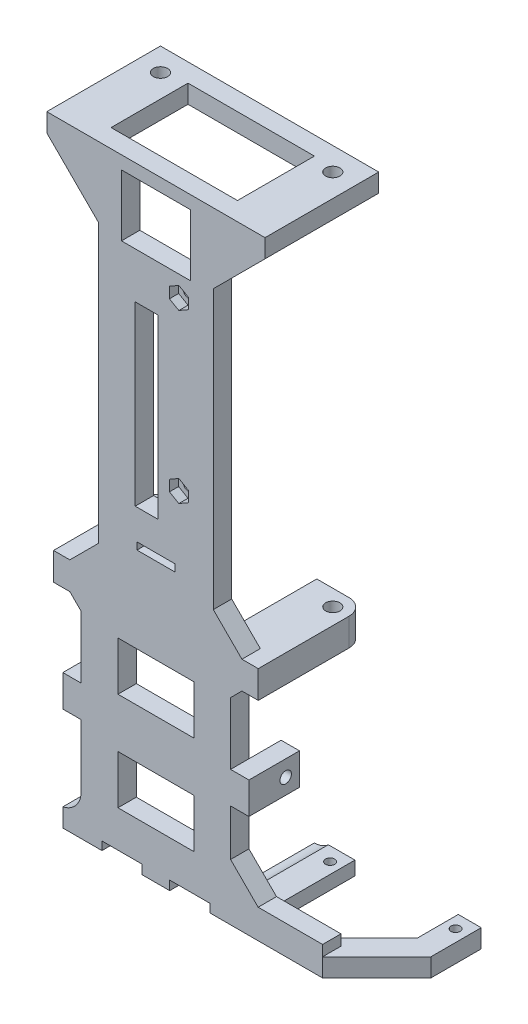
from build123d import *

# Parameters (mm, degrees)
EXTRUDE_1_DEPTH      = 4
SKETCH_2_W           = 15
SKETCH_2_H           = 13.3866
CUT_EXTRUDE_1_DEPTH  = 121.91505324
SKETCH_3_W           = 10
SKETCH_3_H           = 10
SKETCH_3_R           = 1.55
SKETCH_3_H_2         = 14.755
EXTRUDE_2_DEPTH      = 4
EXTRUDE_3_DEPTH      = 4
EXTRUDE_4_DEPTH      = 4
SKETCH_7_W           = 27.52
SKETCH_7_H           = 4
EXTRUDE_5_DEPTH      = 4
EXTRUDE_START        = -4
EXTRUDE_6_DEPTH      = 4
SKETCH_11_W          = 16.52
SKETCH_11_H          = 10.61
CUT_EXTRUDE_2_DEPTH  = 132.394668556
SKETCH_12_W          = 11
SKETCH_12_H          = 6.89
SKETCH_12_R          = 1.25
EXTRUDE_7568_DEPTH   = 4
SKETCH_14_R          = 1
CUT_EXTRUDE_3_DEPTH  = 131.700110654
SKETCH_15_R          = 0.9
EXTRUDE_9_DEPTH      = 1
FILLET_1_R           = 0.9
CUT_EXTRUDE_START    = -2
SKETCH_16_R          = 1
CUT_EXTRUDE_4_DEPTH  = 2
CUT_EXTRUDE_5_DEPTH  = 131.700110654
SKETCH_19_W          = 5
SKETCH_19_H          = 38.5268
SKETCH_19_W_2        = 8.236887868
SKETCH_19_H_2        = 1.55
CUT_EXTRUDE_6_DEPTH  = 131.700110654
EXTRUDE_12_DEPTH     = 23.28
CUT_EXTRUDE_7_REACH  = 99.296
SKETCH_23_R          = 1.55
EXTRUDE_13_DEPTH     = 4
CUT_EXTRUDE_START_2  = -19.28
CUT_EXTRUDE_8_DEPTH  = 19.48
SKETCH_26_W          = 10.1
SKETCH_26_H          = 2
EXTRUDE_14_DEPTH     = 3
EXTRUDE_15_DEPTH     = 18.755
CUT_EXTRUDE_9_REACH  = 145.246
SKETCH_28_R          = 1
EXTRUDE_START_2      = -10.1
EXTRUDE_16_DEPTH     = 10.1
FILLET_2_R           = 5
SKETCH_30_R          = 1
CUT_EXTRUDE_10_DEPTH = 140.530302533


# Read off the part's stored shape, not the designer's step: 切除-拉伸8
with BuildPart() as part:
    # 草图1 → 凸台-拉伸1 (new body)
    with BuildSketch(Plane.XY):
        with BuildLine():
            Line((-16.26, -7.25), (-16.26, 119.75))
            Line((-16.26, 119.75), (16.26, 119.75))
            Line((16.26, 119.75), (16.26, -7.25))
            ThreePointArc((16.26, -7.25), (14.939051583, -10.439051583), (11.75, -11.76))
            Line((11.75, -11.76), (-11.75, -11.76))
            ThreePointArc((-11.75, -11.76), (-14.939051583, -10.439051583), (-16.26, -7.25))
        make_face()
    extrude(amount=EXTRUDE_1_DEPTH)

    # 草图2 → 切除-拉伸1 (cut, through all)
    with BuildSketch(Plane(origin=(0, 0, 0), x_dir=(-1, 0, 0), z_dir=(0, 0, -1))):
        with Locations((0, 110.2067)):
            Rectangle(SKETCH_2_W, SKETCH_2_H)
    extrude(amount=-CUT_EXTRUDE_1_DEPTH, mode=Mode.SUBTRACT)

    # 草图3 → 凸台-拉伸2 (add)
    # profile 1 of 2: a face of its own
    with BuildSketch(Plane(origin=(0, 119.75, 0), x_dir=(1, 0, 0), z_dir=(0, 1, 0))):
        with Locations((-18.76, 15.755)):
            Rectangle(SKETCH_3_W, SKETCH_3_H)
        with Locations(Location((-18.76, 15.755, 0), (0, 0, 270))):
            Circle(SKETCH_3_R, mode=Mode.SUBTRACT)
    # profile 2 of 2: a face of its own
    with BuildSketch(Plane(origin=(0, 119.75, 0), x_dir=(1, 0, 0), z_dir=(0, 1, 0))):
        with Locations((-18.76, 3.3775)):
            Rectangle(SKETCH_3_W, SKETCH_3_H_2)
    extrude_2 = extrude(amount=-EXTRUDE_2_DEPTH)

    # 镜向1: 凸台-拉伸2 across plane
    add(extrude_2.mirror(Plane(origin=(0, 0, 0), x_dir=(0, 0, 1), z_dir=(1, 0, 0))))

    # 草图6 → 凸台-拉伸4 (add)
    with BuildSketch(Plane.XY.offset(4)):
        Polygon((-16.26, 115.75), (-23.76, 115.75), (-16.26, 108.25), align=None)
        Polygon((16.26, 115.75), (16.26, 108.25), (23.76, 115.75), align=None)
    extrude(amount=-EXTRUDE_4_DEPTH)

    # 草图7 → 凸台-拉伸5 (add)
    with BuildSketch(Plane(origin=(0, 119.75, 0), x_dir=(1, 0, 0), z_dir=(0, 1, 0))):
        with Locations((0, 18.755)):
            Rectangle(SKETCH_7_W, SKETCH_7_H)
    extrude(amount=-EXTRUDE_5_DEPTH)



with BuildPart() as body_2:
    # 草图5 → 凸台-拉伸3 (new body)
    with BuildSketch(Plane(origin=(0, -13.58, 0), x_dir=(1, 0, 0), z_dir=(0, 1, 0))):
        Polygon((47.78, 9.855), (43.08, 9.855), (29.225, -4), (36.296067812, -4), (48.08, 7.783932188), (48.08, 9.855), align=None)
        with BuildLine():
            Line((47.78, 18.755), (43.08, 18.755))
            Line((43.08, 18.755), (43.08, 9.855))
            Line((43.08, 9.855), (47.78, 9.855))
            Line((47.78, 9.855), (47.78, 15.105))
            Line((47.78, 15.105), (46.239934208, 15.105))
            ThreePointArc((46.239934208, 15.105), (44.48, 15.755), (46.239934208, 16.405))
            Line((46.239934208, 16.405), (47.78, 16.405))
            Line((47.78, 16.405), (47.78, 18.755))
        make_face()
        with BuildLine():
            Line((48.08, 18.755), (47.78, 18.755))
            Line((47.78, 18.755), (47.78, 16.405))
            Line((47.78, 16.405), (46.239934208, 16.405))
            ThreePointArc((46.239934208, 16.405), (46.418065618, 16.10145764), (46.48, 15.755))
            ThreePointArc((46.48, 15.755), (46.418065618, 15.40854236), (46.239934208, 15.105))
            Line((46.239934208, 15.105), (47.78, 15.105))
            Line((47.78, 15.105), (47.78, 9.855))
            Line((47.78, 9.855), (48.08, 9.855))
            Line((48.08, 9.855), (48.08, 18.755))
        make_face()
    extrude(amount=EXTRUDE_3_DEPTH)


with BuildPart() as part_1:
    add(part.part)

    add(body_2.part)  # 凸台-拉伸6 merges body 2
    # 草图8 → 凸台-拉伸6 (add)
    with BuildSketch(Plane.XY.offset(4).offset(EXTRUDE_START)):
        with BuildLine():
            Line((22.26, -7.25), (16.26, -7.25))
            ThreePointArc((16.26, -7.25), (14.939051583, -10.439051583), (11.75, -11.76))
            Line((11.75, -11.76), (11.75, -13.58))
            Line((11.75, -13.58), (36.296067812, -13.58))
            Line((36.296067812, -13.58), (36.296067812, -7.25))
            Line((36.296067812, -7.25), (22.26, -7.25))
        make_face()
        with BuildLine():
            Line((16.26, -7.25), (11.75, -7.25))
            Line((11.75, -7.25), (11.75, -11.76))
            ThreePointArc((11.75, -11.76), (14.939051583, -10.439051583), (16.26, -7.25))
        make_face()
        Polygon((11.75, 3.26), (11.75, -7.25), (16.26, -7.25), (16.26, -1.25), align=None)
        Polygon((16.26, -1.25), (16.26, -7.25), (22.26, -7.25), align=None)
    extrude(amount=EXTRUDE_6_DEPTH)

    # 草图11 → 切除-拉伸2 (cut, through all)
    with BuildSketch(Plane.XY.offset(4)):
        with Locations((0, 1.545)):
            Rectangle(SKETCH_11_W, SKETCH_11_H)
        with Locations((0, 22.955)):
            Rectangle(SKETCH_11_W, SKETCH_11_H)
    extrude(amount=-CUT_EXTRUDE_2_DEPTH, mode=Mode.SUBTRACT)

    # 草图12 → Extrude 7568 (add)
    with BuildSketch(Plane.ZY.offset(16.26)):
        with Locations((-1.5, 12.295)):
            Rectangle(SKETCH_12_W, SKETCH_12_H)
        with Locations(Location((-4, 12.25, 0), (0, 0, 270))):
            Circle(SKETCH_12_R, mode=Mode.SUBTRACT)
    extrude_7568 = extrude(amount=EXTRUDE_7568_DEPTH)

    # 镜向4: Extrude 7568 across plane
    add(extrude_7568.mirror(Plane(origin=(0, 0, 0), x_dir=(0, 0, 1), z_dir=(1, 0, 0))))

    # 草图14 → 切除-拉伸3 (cut, through all)
    with BuildSketch(Plane(origin=(0, 0, 0), x_dir=(-1, 0, 0), z_dir=(0, 0, -1))):
        with Locations((-5, 62.6)):
            Circle(SKETCH_14_R)
        with Locations((-5, 99)):
            Circle(SKETCH_14_R)
    extrude(amount=-CUT_EXTRUDE_3_DEPTH, mode=Mode.SUBTRACT)

    # 草图15 → 凸台-拉伸9 (add)
    with BuildSketch(Plane(origin=(0, 0, 0), x_dir=(-1, 0, 0), z_dir=(0, 0, -1))):
        with Locations(Location((-5, 94.35, 0), (0, 0, 180))):
            Circle(SKETCH_15_R)
        with Locations(Location((-5, 57.98, 0), (0, 0, 180))):
            Circle(SKETCH_15_R)
    extrude(amount=EXTRUDE_9_DEPTH)

    # 圆角1
    fillet_1_edges = [part_1.edges().sort_by_distance(p)[0] for p in [
        (4.1, 94.35, -1),
        (4.1, 57.98, -1),
    ]]
    fillet(fillet_1_edges, radius=FILLET_1_R)

    # 草图16 → 切除-拉伸4 (cut)
    # profile 1 of 2: a face of its own
    with BuildSketch(Plane.XY.offset(4).offset(CUT_EXTRUDE_START)):
        Polygon((7.05, 61.416431948), (7.05, 63.783568052), (5, 64.967136104), (2.95, 63.783568052), (2.95, 61.416431948), (5, 60.232863896), align=None)
        with Locations(Location((5, 62.6, 0), (0, 0, 180))):
            Circle(SKETCH_16_R, mode=Mode.SUBTRACT)
    # profile 2 of 2: a face of its own
    with BuildSketch(Plane.XY.offset(4).offset(CUT_EXTRUDE_START)):
        Polygon((2.95, 97.816431948), (5, 96.632863896), (7.05, 97.816431948), (7.05, 100.183568052), (5, 101.367136104), (2.95, 100.183568052), align=None)
        with Locations(Location((5, 99, 0), (0, 0, 180))):
            Circle(SKETCH_16_R, mode=Mode.SUBTRACT)
    extrude(amount=CUT_EXTRUDE_4_DEPTH, mode=Mode.SUBTRACT)

    # 草图17 → 切除-拉伸5 (cut, symmetric)
    with BuildSketch(Plane(origin=(0, 0, 0), x_dir=(-1, 0, 0), z_dir=(0, 0, -1))):
        Polygon((-12.5, 104.49), (-16.26, 108.25), (-16.26, 40.2266), (-12.5, 43.9866), align=None)
    cut_extrude_5 = extrude(amount=CUT_EXTRUDE_5_DEPTH, both=True, mode=Mode.SUBTRACT)

    # 镜向2: 切除-拉伸5 across plane
    add(cut_extrude_5.mirror(Plane(origin=(0, 0, 0), x_dir=(0, 0, 1), z_dir=(1, 0, 0))), mode=Mode.SUBTRACT)

    # 草图19 → 切除-拉伸6 (cut, through all)
    with BuildSketch(Plane(origin=(0, 0, 0), x_dir=(-1, 0, 0), z_dir=(0, 0, -1))):
        with Locations((2, 74.25)):
            Rectangle(SKETCH_19_W, SKETCH_19_H)
        with Locations((0, 47.675)):
            Rectangle(SKETCH_19_W_2, SKETCH_19_H_2)
    extrude(amount=-CUT_EXTRUDE_6_DEPTH, mode=Mode.SUBTRACT)

    # 草图22 → 凸台-拉伸12 (add)
    with BuildSketch(Plane.XY.offset(4)):
        with BuildLine():
            Line((16.26, 32.704986911), (16.26, 31.75))
            Line((16.26, 31.75), (22.285, 31.75))
            Line((22.285, 31.75), (22.285, 37.75))
            Line((22.285, 37.75), (11.75, 37.75))
            Line((11.75, 37.75), (11.75, 36.36))
            ThreePointArc((11.75, 36.36), (14.652551493, 35.331521301), (16.26, 32.704986911))
        make_face()
    extrude_12 = extrude(amount=-EXTRUDE_12_DEPTH)

    # 草图23 → 切除-拉伸7 (cut, up to next)
    with BuildSketch(Plane(origin=(0, 37.75, 0), x_dir=(1, 0, 0), z_dir=(0, 1, 0)), mode=Mode.PRIVATE) as cut_extrude_7_sk1:
        with Locations(Location((18.76, 15.755, 0), (0, 0, 270))):
            Circle(SKETCH_23_R)
    cut_extrude_7_tool1 = extrude(cut_extrude_7_sk1.sketch, amount=-CUT_EXTRUDE_7_REACH, mode=Mode.PRIVATE) & part_1.part
    # 草图23 → 切除-拉伸7 (cut, up to next)
    with BuildSketch(Plane(origin=(0, 37.75, 0), x_dir=(1, 0, 0), z_dir=(0, 1, 0)), mode=Mode.PRIVATE) as cut_extrude_7_sk2:
        with BuildLine():
            ThreePointArc((18.76, 19.28), (21.252551404, 18.247551404), (22.285, 15.755))
            Line((22.285, 15.755), (22.285, 19.28))
            Line((22.285, 19.28), (18.76, 19.28))
        make_face()
    cut_extrude_7_tool2 = extrude(cut_extrude_7_sk2.sketch, amount=-CUT_EXTRUDE_7_REACH, mode=Mode.PRIVATE) & part_1.part
    cut_extrude_7_1 = cut_extrude_7_tool1.solids().sort_by_distance((18.76, 37.75, -15.755))[0]
    add(cut_extrude_7_1, mode=Mode.SUBTRACT)
    cut_extrude_7_2 = cut_extrude_7_tool2.solids().sort_by_distance((21.497628, 37.75, -18.492628))[0]
    add(cut_extrude_7_2, mode=Mode.SUBTRACT)
    cut_extrude_7 = cut_extrude_7_1 + cut_extrude_7_2  # 切除-拉伸7 as one shape, for the pattern or mirror that repeats it

    # 草图24 → 凸台-拉伸13 (add)
    with BuildSketch(Plane.XY.offset(4)):
        Polygon((16.26, 40.2266), (18.7366, 37.75), (18.7366, 31.75), (16.26, 29.2734), align=None)
    extrude_13 = extrude(amount=-EXTRUDE_13_DEPTH)

    # 镜向3: 凸台-拉伸12, 切除-拉伸7, 凸台-拉伸13 across plane
    add(extrude_12.mirror(Plane(origin=(0, 0, 0), x_dir=(0, 0, 1), z_dir=(1, 0, 0))))
    add(cut_extrude_7.mirror(Plane(origin=(0, 0, 0), x_dir=(0, 0, 1), z_dir=(1, 0, 0))), mode=Mode.SUBTRACT)
    add(extrude_13.mirror(Plane(origin=(0, 0, 0), x_dir=(0, 0, 1), z_dir=(1, 0, 0))))

    # 切除-拉伸8 outline → 切除-拉伸8 (cut)
    with BuildSketch(Plane.XY.offset(CUT_EXTRUDE_START_2)):
        with BuildLine():
            ThreePointArc((-16.26, 31.75), (-16.176051621, 32.616121846), (-15.927331684, 33.45))
            Line((-15.927331684, 33.45), (-22.285, 33.45))
            Line((-22.285, 33.45), (-22.285, 31.75))
            Line((-22.285, 31.75), (-16.26, 31.75))
        make_face()
    extrude(amount=CUT_EXTRUDE_8_DEPTH, mode=Mode.SUBTRACT)

    # 草图26 → 凸台-拉伸14 (add, symmetric)
    with BuildSketch(Plane(origin=(0, 0, 0), x_dir=(0, 0, -1), z_dir=(1, 0, 0))):
        with Locations((1.05, -12.76)):
            Rectangle(SKETCH_26_W, SKETCH_26_H)
        Polygon((8.1, -11.76), (8.1, -13.76), (6.1, -13.76), (6.1, -11.76), (6.1, -10.76), (7.1, -10.76), align=None)
    extrude(amount=EXTRUDE_14_DEPTH, both=True)

    # 草图27 → 凸台-拉伸15 (add)
    with BuildSketch(Plane(origin=(0, 0, 0), x_dir=(-1, 0, 0), z_dir=(0, 0, -1))):
        with BuildLine():
            Line((-11.75, -11.76), (-11.75, -13.58))
            Line((-11.75, -13.58), (-20.58, -13.58))
            Line((-20.58, -13.58), (-20.58, -10.58))
            Line((-20.58, -10.58), (-14.791578538, -10.58))
            ThreePointArc((-14.791578538, -10.58), (-13.381226532, -11.454664077), (-11.75, -11.76))
        make_face()
    extrude(amount=EXTRUDE_15_DEPTH)

    # 草图28 → 切除-拉伸9 (cut, up to next)
    with BuildSketch(Plane.XZ.offset(13.58), mode=Mode.PRIVATE) as cut_extrude_9_sk1:
        with Locations((18.18, -15.755)):
            Circle(SKETCH_28_R)
    cut_extrude_9_tool1 = extrude(cut_extrude_9_sk1.sketch, amount=-CUT_EXTRUDE_9_REACH, mode=Mode.PRIVATE) & part_1.part
    add(cut_extrude_9_tool1.solids().sort_by_distance((18.18, -13.58, -15.755))[0], mode=Mode.SUBTRACT)

    # 草图29 → 凸台-拉伸16 (add)
    with BuildSketch(Plane.XY.offset(4).offset(EXTRUDE_START_2)):
        with BuildLine():
            Line((-20.26, -9.58), (-15.611502298, -9.58))
            ThreePointArc((-15.611502298, -9.58), (-13.967182897, -11.177365529), (-11.75, -11.76))
            Line((-11.75, -11.76), (-11.75, -13.58))
            Line((-11.75, -13.58), (-20.26, -13.58))
            Line((-20.26, -13.58), (-20.26, -9.58))
        make_face()
    extrude(amount=EXTRUDE_16_DEPTH)

    # 圆角2
    # the kernel refuses this fillet: 5 mm, written as the material it adds along each edge
    with BuildSketch(Plane(origin=(-15.611502298, -9.58, 0), x_dir=(-0.13122927433436546, 0.9913520452178812, 0), z_dir=(0, 0, 1))) as fillet_2_piece_1:
        with BuildLine():
            CenterArc((5.597861587, 4.956760226), FILLET_2_R, 183.996325889, 78.463040967)
            Line((0.61001898, 4.608297704), (0.111234719, 4.573451452))
            ThreePointArc((0.111234719, 4.573451452), (-0.190666533, 2.369763489), (-0.495676023, 0.065614637))
            Line((-0.495676023, 0.065614637), (0.199901122, -0.458300711))
            ThreePointArc((0.199901122, -0.458300711), (2.329337511, -0.158550709), (4.876100578, -0.495676023))
            Line((4.876100578, -0.495676023), (4.941715215, 0))
        make_face()
    extrude(amount=4)

    # 草图30 → 切除-拉伸10 (cut, through all)
    with BuildSketch(Plane(origin=(0, -9.58, 0), x_dir=(1, 0, 0), z_dir=(0, 1, 0))):
        with Locations(Location((-17.76, 3.05, 0), (0, 0, 270))):
            Circle(SKETCH_30_R)
    extrude(amount=-CUT_EXTRUDE_10_DEPTH, mode=Mode.SUBTRACT)


solid = part_1.part
